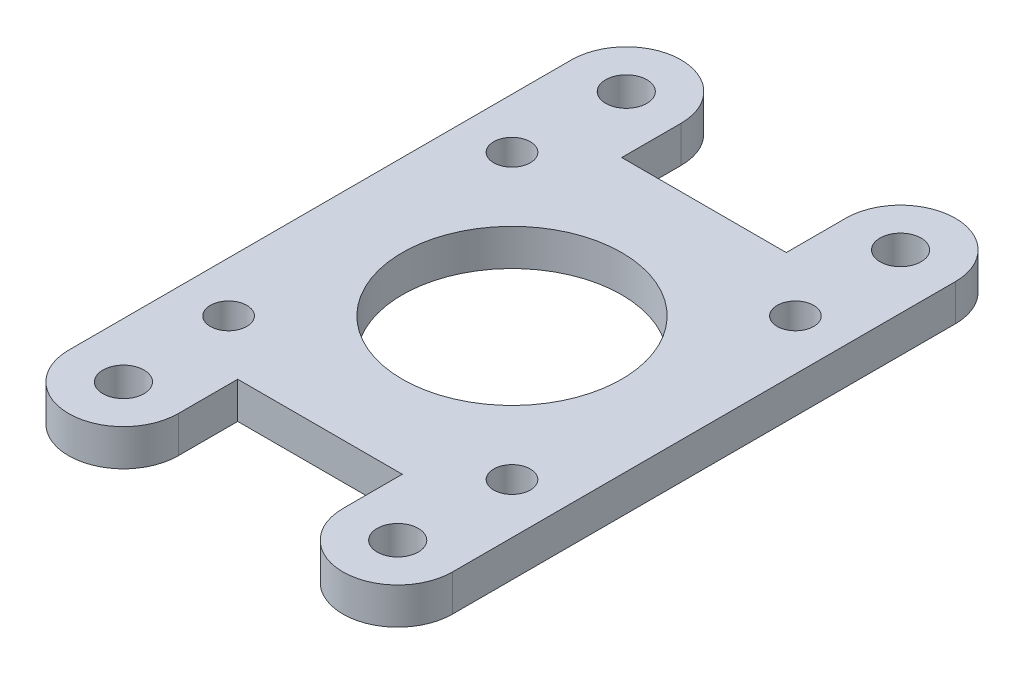
from build123d import *

# Parameters (mm, degrees)
SKETCH1_W          = 42
SKETCH1_H          = 42
BASE_FLANGE1_DEPTH = 4
SKETCH4_R          = 2.25
TAB1_DEPTH         = 4
SKETCH5_R          = 12
SKETCH5_R_2        = 2
CUT_EXTRUDE1_DEPTH = 40.73977856


# Sheet-metal steps are written as plain solids
with BuildPart() as part:
    # Sketch1 → Base-Flange1 (new body)
    with BuildSketch(Plane(origin=(0, 0, 0), x_dir=(1, 0, 0), z_dir=(0, 1, 0))):
        Rectangle(SKETCH1_W, SKETCH1_H)
    extrude(amount=-BASE_FLANGE1_DEPTH)

    # Sketch4 → Tab1 (add)
    # profile 1 of 2: a face of its own
    with BuildSketch(Plane(origin=(0, 0, 0), x_dir=(1, 0, 0), z_dir=(0, 1, 0))):
        with BuildLine():
            Line((-9, 27.5), (-9, -27.5))
            ThreePointArc((-9, -27.5), (-15, -33.5), (-21, -27.5))
            Line((-21, -27.5), (-21, 27.5))
            ThreePointArc((-21, 27.5), (-15, 33.5), (-9, 27.5))
        make_face()
        with Locations(Location((-15, 27.5, 0), (0, 0, 270))):
            Circle(SKETCH4_R, mode=Mode.SUBTRACT)
        with Locations(Location((-15, -27.5, 0), (0, 0, 270))):
            Circle(SKETCH4_R, mode=Mode.SUBTRACT)
    # profile 2 of 2: a face of its own
    with BuildSketch(Plane(origin=(0, 0, 0), x_dir=(1, 0, 0), z_dir=(0, 1, 0))):
        with BuildLine():
            Line((21, 27.5), (21, -27.5))
            ThreePointArc((21, -27.5), (15, -33.5), (9, -27.5))
            Line((9, -27.5), (9, 27.5))
            ThreePointArc((9, 27.5), (15, 33.5), (21, 27.5))
        make_face()
        with Locations(Location((15, 27.5, 0), (0, 0, 270))):
            Circle(SKETCH4_R, mode=Mode.SUBTRACT)
        with Locations(Location((15, -27.5, 0), (0, 0, 270))):
            Circle(SKETCH4_R, mode=Mode.SUBTRACT)
    extrude(amount=-TAB1_DEPTH)

    # Sketch5 → Cut-Extrude1 (cut, through all)
    with BuildSketch(Plane(origin=(0, 0, 0), x_dir=(1, 0, 0), z_dir=(0, 1, 0))):
        with Locations(Location((0, 0, 0), (0, 0, 270))):
            Circle(SKETCH5_R)
        with Locations(Location((15.5, 15.5, 0), (0, 0, 270))):
            Circle(SKETCH5_R_2)
        with Locations(Location((15.5, -15.5, 0), (0, 0, 270))):
            Circle(SKETCH5_R_2)
        with Locations(Location((-15.5, -15.5, 0), (0, 0, 270))):
            Circle(SKETCH5_R_2)
        with Locations(Location((-15.5, 15.5, 0), (0, 0, 270))):
            Circle(SKETCH5_R_2)
    extrude(amount=-CUT_EXTRUDE1_DEPTH, mode=Mode.SUBTRACT)


solid = part.part
